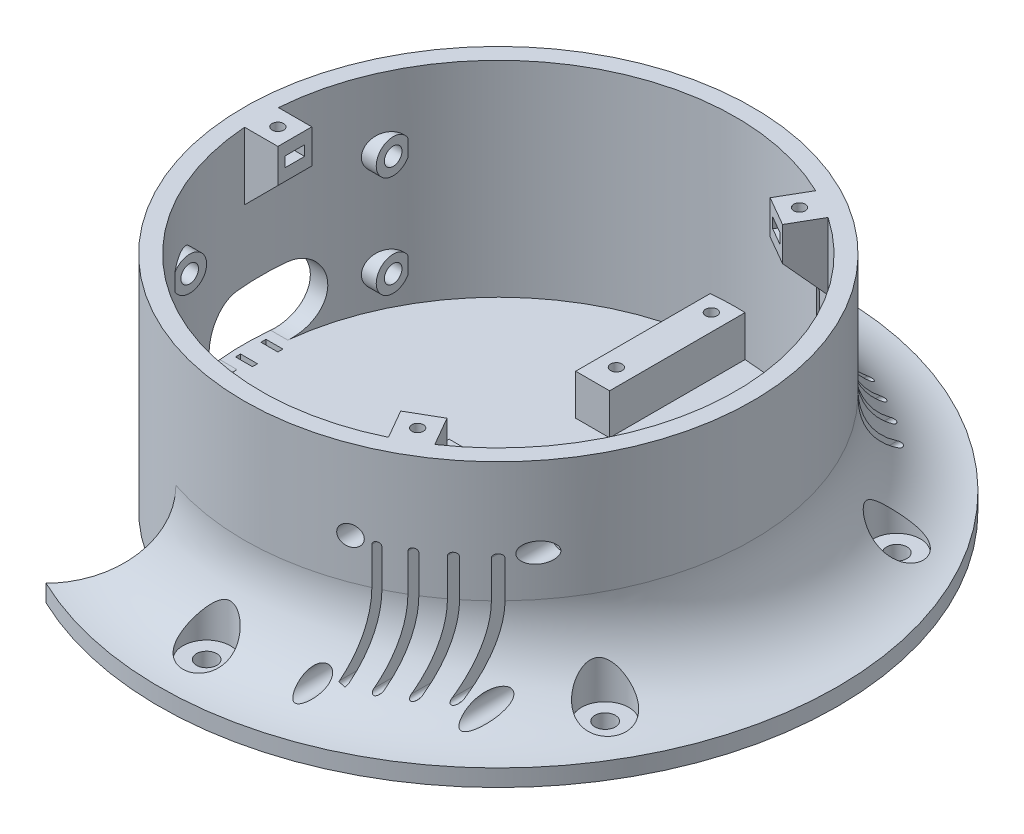
from build123d import *

# Parameters (mm, degrees)
CORTAR_EXTRUIR1_DEPTH       = 109
SALIENTE_EXTRUIR1_DEPTH     = 5
CROQUIS4_R                  = 1.7
CORTAR_EXTRUIR2_DEPTH       = 22
CORTAR_EXTRUIR3_DEPTH       = 1.5
MATRIZC1_COUNT              = 3
CROQUIS6_R                  = 3
CORTAR_EXTRUIR4_DEPTH       = 30.35
CROQUIS7_R                  = 7
CORTAR_EXTRUIR5_DEPTH       = 15
MATRIZC2_COUNT              = 6
CROQUIS8_R                  = 1.7
CORTAR_EXTRUIR6_DEPTH       = 15
CROQUIS9_R                  = 2.95
CORTAR_EXTRUIR7_DEPTH       = 2.5
SALIENTE_EXTRUIR2_DEPTH     = 12
CROQUIS11_R                 = 1.7
CORTAR_EXTRUIR8_DEPTH       = 21
CORTAR_EXTRUIR9_DEPTH       = 3
MATRIZL1_COUNT              = 2
MATRIZL1_PITCH              = 28
CROQUIS13_W                 = 42
CROQUIS13_H                 = 10
CORTAR_EXTRUIR10_DEPTH      = 42
SALIENTE_EXTRUIR3_DEPTH     = 42
CORTAR_EXTRUIR11_DEPTH      = 129
CORTAR_EXTRUIR11_DEPTH_BACK = 42
CROQUIS16_R                 = 1.7
CORTAR_EXTRUIR12_DEPTH      = 67
CROQUIS17_R                 = 2.95
CORTAR_EXTRUIR13_DEPTH      = 37
CROQUIS18_R                 = 2.95
CORTAR_EXTRUIR14_DEPTH      = 61
CORTAR_EXTRUIR15_DEPTH      = 105
CROQUIS22_R                 = 2.6
CORTAR_EXTRUIR16_DEPTH      = 14
SALIENTE_EXTRUIR4_REACH     = 202.527
CROQUIS23_R                 = 5
CROQUIS23_R_2               = 2.6
CROQUIS21_W                 = 5
CROQUIS21_H                 = 1.5
CORTAR_EXTRUIR17_DEPTH      = 18


with BuildPart() as part:
    # Croquis1 → Revolución1 (revolve)
    with BuildSketch(Plane.XY):
        with BuildLine():
            Line((0, 5), (0, 0))
            Line((0, 0), (100, 0))
            Line((100, 0), (100, 5))
            ThreePointArc((100, 5), (82.32233047, 12.32233047), (75, 30))
            Line((75, 30), (75, 65.5))
            Line((75, 65.5), (70, 65.5))
            Line((70, 65.5), (70, 5))
            Line((70, 5), (0, 5))
        make_face()
    revolve(axis=Axis((0, 78.038709788, 0), (0, -1, 0)))

    # Croquis2 → Cortar-Extruir1 (cut)
    with BuildSketch(Plane(origin=(0, 65.5, 0), x_dir=(1, 0, 0), z_dir=(0, 1, 0))):
        with BuildLine():
            Line((-112.943684306, 100), (-112.943684306, -100))
            Line((-112.943684306, -100), (-52.943684306, -100))
            Line((-52.943684306, -100), (-24, -71.056315694))
            ThreePointArc((-24, -71.056315694), (-75, 0), (-24, 71.056315694))
            Line((-24, 71.056315694), (-52.943684306, 100))
            Line((-52.943684306, 100), (-112.943684306, 100))
        make_face()
    extrude(amount=-CORTAR_EXTRUIR1_DEPTH, mode=Mode.SUBTRACT)

    # Croquis3 → Saliente-Extruir1 (add, symmetric)
    with BuildSketch(Plane.XY):
        Polygon((-72, 65.5), (-72, 43.5), (-60, 55.5), (-60, 65.5), (-70, 65.5), align=None)
    saliente_extruir1 = extrude(amount=SALIENTE_EXTRUIR1_DEPTH, both=True)

    # Croquis4 → Cortar-Extruir2 (cut)
    with BuildSketch(Plane(origin=(0, 65.5, 0), x_dir=(1, 0, 0), z_dir=(0, 1, 0))):
        with Locations((-65, 0)):
            Circle(CROQUIS4_R)
    cortar_extruir2 = extrude(amount=-CORTAR_EXTRUIR2_DEPTH, mode=Mode.SUBTRACT)

    # Croquis5 → Cortar-Extruir3 (cut, symmetric)
    with BuildSketch(Plane(origin=(0, 60.5, 0), x_dir=(1, 0, 0), z_dir=(0, 1, 0))):
        Polygon((-63.325, 2.901185103), (-56.675, 2.901185103), (-56.675, -2.901185103), (-63.325, -2.901185103), (-66.675, -2.901185103), (-68.35, 0), (-66.675, 2.901185103), align=None)
    cortar_extruir3 = extrude(amount=CORTAR_EXTRUIR3_DEPTH, both=True, mode=Mode.SUBTRACT)

    # MatrizC1: Saliente-Extruir1, Cortar-Extruir2, Cortar-Extruir3 ×3 about axis
    matrizc1_axis = Axis((0, 65.5, 0), (0, 1, 0))
    add([saliente_extruir1.rotate(matrizc1_axis, i * 360 / MATRIZC1_COUNT) for i in range(1, MATRIZC1_COUNT)])
    add([cortar_extruir2.rotate(matrizc1_axis, i * 360 / MATRIZC1_COUNT) for i in range(1, MATRIZC1_COUNT)], mode=Mode.SUBTRACT)
    add([cortar_extruir3.rotate(matrizc1_axis, i * 360 / MATRIZC1_COUNT) for i in range(1, MATRIZC1_COUNT)], mode=Mode.SUBTRACT)

    # Croquis6 → Cortar-Extruir4 (cut)
    with BuildSketch(Plane.XZ):
        with Locations((0, -86)):
            Circle(CROQUIS6_R)
    cortar_extruir4 = extrude(amount=-CORTAR_EXTRUIR4_DEPTH, mode=Mode.SUBTRACT)

    # Croquis7 → Cortar-Extruir5 (cut)
    with BuildSketch(Plane(origin=(0, 20, 0), x_dir=(-1, 0, 0), z_dir=(0, -1, 0))):
        with Locations((0, 86)):
            Circle(CROQUIS7_R)
    cortar_extruir5 = extrude(amount=CORTAR_EXTRUIR5_DEPTH, mode=Mode.SUBTRACT)

    # MatrizC2: Cortar-Extruir4, Cortar-Extruir5 ×6 about axis
    matrizc2_axis = Axis((0, 0, 0), (0, 1, 0))
    add([cortar_extruir4.rotate(matrizc2_axis, i * 360 / MATRIZC2_COUNT) for i in range(1, MATRIZC2_COUNT)], mode=Mode.SUBTRACT)
    add([cortar_extruir5.rotate(matrizc2_axis, i * 360 / MATRIZC2_COUNT) for i in range(1, MATRIZC2_COUNT)], mode=Mode.SUBTRACT)

    # Croquis8 → Cortar-Extruir6 (cut)
    with BuildSketch(Plane.XZ):
        with Locations((24.5, 15.5)):
            Circle(CROQUIS8_R)
        with Locations((55.5, 15.5)):
            Circle(CROQUIS8_R)
        with Locations((24.5, -15.5)):
            Circle(CROQUIS8_R)
        with Locations((55.5, -15.5)):
            Circle(CROQUIS8_R)
    extrude(amount=-CORTAR_EXTRUIR6_DEPTH, mode=Mode.SUBTRACT)

    # Croquis9 → Cortar-Extruir7 (cut)
    with BuildSketch(Plane.XZ):
        with Locations((24.5, 15.5)):
            Circle(CROQUIS9_R)
        with Locations((24.5, -15.5)):
            Circle(CROQUIS9_R)
        with Locations((55.5, -15.5)):
            Circle(CROQUIS9_R)
        with Locations((55.5, 15.5)):
            Circle(CROQUIS9_R)
    extrude(amount=-CORTAR_EXTRUIR7_DEPTH, mode=Mode.SUBTRACT)

    # Croquis10 → Saliente-Extruir2 (add)
    with BuildSketch(Plane(origin=(0, 5, 0), x_dir=(1, 0, 0), z_dir=(0, 1, 0))):
        with BuildLine():
            Line((2.8, 30), (-7.2, 30))
            Line((-7.2, 30), (-7.2, 69.628729703))
            ThreePointArc((-7.2, 69.628729703), (-2.205639433, 69.965242476), (2.8, 69.943977582))
            Line((2.8, 69.943977582), (2.8, 30))
        make_face()
    extrude(amount=SALIENTE_EXTRUIR2_DEPTH)

    # Croquis11 → Cortar-Extruir8 (cut)
    with BuildSketch(Plane(origin=(0, 17, 0), x_dir=(1, 0, 0), z_dir=(0, 1, 0))):
        with Locations((-2.2, 37)):
            Circle(CROQUIS11_R)
    cortar_extruir8 = extrude(amount=-CORTAR_EXTRUIR8_DEPTH, mode=Mode.SUBTRACT)

    # Croquis12 → Cortar-Extruir9 (cut)
    with BuildSketch(Plane(origin=(0, 10.65, 0), x_dir=(1, 0, 0), z_dir=(0, 1, 0))):
        Polygon((-3.875, 39.901185103), (-10.525, 39.901185103), (-10.525, 34.098814897), (-3.875, 34.098814897), (-0.525, 34.098814897), (1.15, 37), (-0.525, 39.901185103), align=None)
    cortar_extruir9 = extrude(amount=-CORTAR_EXTRUIR9_DEPTH, mode=Mode.SUBTRACT)

    # MatrizL1: Cortar-Extruir8, Cortar-Extruir9 ×2
    with Locations(*[(0, 0, -i * MATRIZL1_PITCH) for i in range(1, MATRIZL1_COUNT)]):
        add(cortar_extruir8, mode=Mode.SUBTRACT)
        add(cortar_extruir9, mode=Mode.SUBTRACT)

    # Croquis13 → Cortar-Extruir10 (cut)
    with BuildSketch(Plane(origin=(0, 5, 0), x_dir=(1, 0, 0), z_dir=(0, 1, 0))):
        with Locations((42.5, -31)):
            Rectangle(CROQUIS13_W, CROQUIS13_H)
    extrude(amount=CORTAR_EXTRUIR10_DEPTH, mode=Mode.SUBTRACT)

    # Croquis14 → Saliente-Extruir3 (add)
    with BuildSketch(Plane(origin=(0, 5, 0), x_dir=(1, 0, 0), z_dir=(0, 1, 0))):
        with BuildLine():
            ThreePointArc((21.5, -66.616439413), (43.54609425, -54.806365283), (60.033324079, -36))
            Line((60.033324079, -36), (21.5, -36))
            Line((21.5, -36), (21.5, -66.616439413))
        make_face()
    extrude(amount=SALIENTE_EXTRUIR3_DEPTH)

    # Croquis15 → Cortar-Extruir11 (cut, two sides: drawn at the far end of the back side and taken through both)
    with BuildSketch(Plane(origin=(0, 0, 36), x_dir=(-1, 0, 0), z_dir=(0, 0, -1)).offset(-CORTAR_EXTRUIR11_DEPTH_BACK)):
        with BuildLine():
            Line((-52, 41), (-52, 11))
            ThreePointArc((-52, 11), (-53, 10), (-54, 11))
            Line((-54, 11), (-54, 41))
            ThreePointArc((-54, 41), (-53, 42), (-52, 41))
        make_face()
        with BuildLine():
            Line((-31, 41), (-31, 11))
            ThreePointArc((-31, 11), (-32, 10), (-33, 11))
            Line((-33, 11), (-33, 41))
            ThreePointArc((-33, 41), (-32, 42), (-31, 41))
        make_face()
        with BuildLine():
            Line((-45, 41), (-45, 11))
            ThreePointArc((-45, 11), (-46, 10), (-47, 11))
            Line((-47, 11), (-47, 41))
            ThreePointArc((-47, 41), (-46, 42), (-45, 41))
        make_face()
        with BuildLine():
            Line((-38, 41), (-38, 11))
            ThreePointArc((-38, 11), (-39, 10), (-40, 11))
            Line((-40, 11), (-40, 41))
            ThreePointArc((-40, 41), (-39, 42), (-38, 41))
        make_face()
    extrude(amount=CORTAR_EXTRUIR11_DEPTH + CORTAR_EXTRUIR11_DEPTH_BACK, mode=Mode.SUBTRACT)

    # Croquis16 → Cortar-Extruir12 (cut)
    with BuildSketch(Plane(origin=(0, 0, 36), x_dir=(-1, 0, 0), z_dir=(0, 0, -1))):
        with Locations((-58.5, 42)):
            Circle(CROQUIS16_R)
        with Locations((-26.5, 42)):
            Circle(CROQUIS16_R)
        with Locations((-58.5, 10)):
            Circle(CROQUIS16_R)
        with Locations((-26.5, 10)):
            Circle(CROQUIS16_R)
    extrude(amount=-CORTAR_EXTRUIR12_DEPTH, mode=Mode.SUBTRACT)

    # Croquis17 → Cortar-Extruir13 (cut)
    with BuildSketch(Plane(origin=(0, 0, 101), x_dir=(-1, 0, 0), z_dir=(0, 0, -1))):
        with Locations((-26.5, 42)):
            Circle(CROQUIS17_R)
        with Locations((-26.5, 10)):
            Circle(CROQUIS17_R)
    extrude(amount=CORTAR_EXTRUIR13_DEPTH, mode=Mode.SUBTRACT)

    # Croquis18 → Cortar-Extruir14 (cut)
    with BuildSketch(Plane(origin=(0, 0, 101), x_dir=(-1, 0, 0), z_dir=(0, 0, -1))):
        with Locations((-58.5, 42)):
            Circle(CROQUIS18_R)
        with Locations((-58.5, 10)):
            Circle(CROQUIS18_R)
    extrude(amount=CORTAR_EXTRUIR14_DEPTH, mode=Mode.SUBTRACT)

    # Croquis19 → Cortar-Extruir15 (cut)
    with BuildSketch(Plane(origin=(0, 0, 0), x_dir=(0, 0, -1), z_dir=(1, 0, 0))):
        with BuildLine():
            Line((7.5, 5), (-7.5, 5))
            ThreePointArc((-7.5, 5), (-17.5, 15), (-7.5, 25))
            Line((-7.5, 25), (7.5, 25))
            ThreePointArc((7.5, 25), (17.5, 15), (7.5, 5))
        make_face()
    extrude(amount=-CORTAR_EXTRUIR15_DEPTH, mode=Mode.SUBTRACT)

    # Croquis22 → Cortar-Extruir16 (cut)
    with BuildSketch(Plane.ZY.offset(75)):
        with Locations((-30, 45)):
            Circle(CROQUIS22_R)
        with Locations((-30, 15)):
            Circle(CROQUIS22_R)
        with Locations((30, 15)):
            Circle(CROQUIS22_R)
        with Locations((30, 45)):
            Circle(CROQUIS22_R)
    extrude(amount=-CORTAR_EXTRUIR16_DEPTH, mode=Mode.SUBTRACT)

    # Croquis23 → Saliente-Extruir4 (add, up to next)
    with BuildSketch(Plane(origin=(-61, 0, 0), x_dir=(0, 0, -1), z_dir=(1, 0, 0)), mode=Mode.PRIVATE) as saliente_extruir4_sk1:
        with Locations((-30, 45)):
            Circle(CROQUIS23_R)
        with Locations((-30, 45)):
            Circle(CROQUIS23_R_2, mode=Mode.SUBTRACT)
    saliente_extruir4_tool1 = extrude(saliente_extruir4_sk1.sketch, amount=-SALIENTE_EXTRUIR4_REACH, mode=Mode.PRIVATE) - part.part
    # Croquis23 → Saliente-Extruir4 (add, up to next)
    with BuildSketch(Plane(origin=(-61, 0, 0), x_dir=(0, 0, -1), z_dir=(1, 0, 0)), mode=Mode.PRIVATE) as saliente_extruir4_sk2:
        with Locations((-30, 15)):
            Circle(CROQUIS23_R)
        with Locations((-30, 15)):
            Circle(CROQUIS23_R_2, mode=Mode.SUBTRACT)
    saliente_extruir4_tool2 = extrude(saliente_extruir4_sk2.sketch, amount=-SALIENTE_EXTRUIR4_REACH, mode=Mode.PRIVATE) - part.part
    # Croquis23 → Saliente-Extruir4 (add, up to next)
    with BuildSketch(Plane(origin=(-61, 0, 0), x_dir=(0, 0, -1), z_dir=(1, 0, 0)), mode=Mode.PRIVATE) as saliente_extruir4_sk3:
        with Locations((30, 15)):
            Circle(CROQUIS23_R)
        with Locations((30, 15)):
            Circle(CROQUIS23_R_2, mode=Mode.SUBTRACT)
    saliente_extruir4_tool3 = extrude(saliente_extruir4_sk3.sketch, amount=-SALIENTE_EXTRUIR4_REACH, mode=Mode.PRIVATE) - part.part
    # Croquis23 → Saliente-Extruir4 (add, up to next)
    with BuildSketch(Plane(origin=(-61, 0, 0), x_dir=(0, 0, -1), z_dir=(1, 0, 0)), mode=Mode.PRIVATE) as saliente_extruir4_sk4:
        with Locations((30, 45)):
            Circle(CROQUIS23_R)
        with Locations((30, 45)):
            Circle(CROQUIS23_R_2, mode=Mode.SUBTRACT)
    saliente_extruir4_tool4 = extrude(saliente_extruir4_sk4.sketch, amount=-SALIENTE_EXTRUIR4_REACH, mode=Mode.PRIVATE) - part.part
    add(saliente_extruir4_tool1.solids().sort_by_distance((-61, 45, 34.858579))[0])
    add(saliente_extruir4_tool2.solids().sort_by_distance((-61, 15, 34.858579))[0])
    add(saliente_extruir4_tool3.solids().sort_by_distance((-61, 15, -25.141421))[0])
    add(saliente_extruir4_tool4.solids().sort_by_distance((-61, 45, -25.141421))[0])

    # Croquis21 → Cortar-Extruir17 (cut)
    with BuildSketch(Plane(origin=(0, 5, 0), x_dir=(1, 0, 0), z_dir=(0, 1, 0))):
        with Locations((-70.5, 3.75)):
            Rectangle(CROQUIS21_W, CROQUIS21_H)
        with Locations((-70.5, -3.75)):
            Rectangle(CROQUIS21_W, CROQUIS21_H)
    extrude(amount=-CORTAR_EXTRUIR17_DEPTH, mode=Mode.SUBTRACT)


solid = part.part
